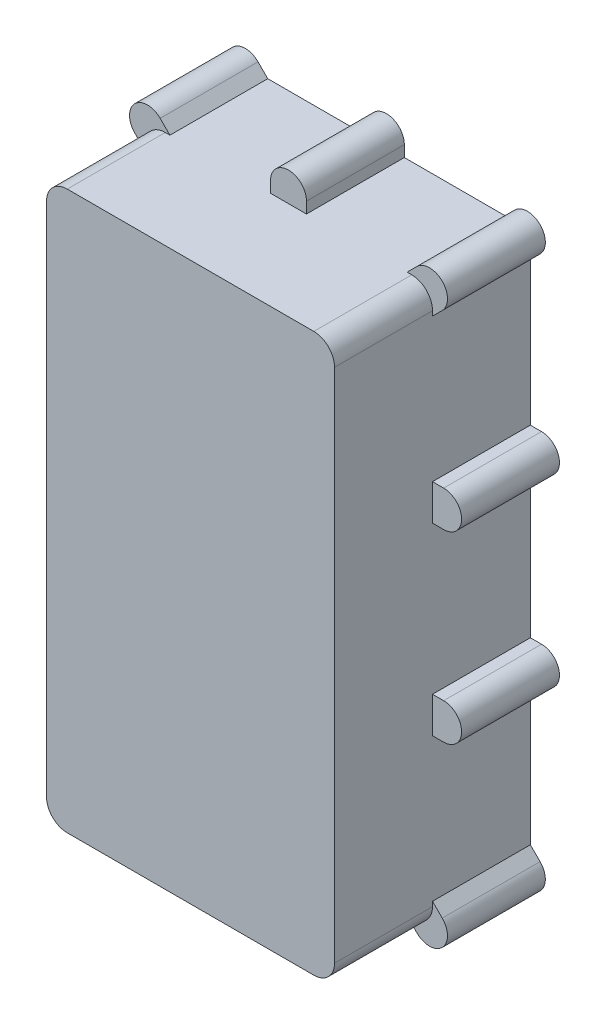
from build123d import *

# Parameters (mm, degrees)
SKETCH3_W               = 76.2
SKETCH3_H               = 158.75
BOSS_EXTRUDE1_DEPTH     = 53.975
SHELL1_T                = 6
FILLET1_R               = 5.334
FILLET2_R               = 6.35
CUT_EXTRUDE1_DEPTH      = 1.2446
FILLET3_R               = 0.254
FILLET4_R               = 0.127
SKETCH7_W               = 76.2
SKETCH7_H               = 2.5
BOSS_EXTRUDE2_DEPTH     = 53.975
BOSS_EXTRUDE3_DEPTH     = 29.972
SKETCH9_R               = 3.025
CUT_EXTRUDE2_DEPTH      = 9
MIRROR2_COPY_1_DEPTH    = 29.972
MIRROR2_COPY_2_SKETCH_R = 3.025
MIRROR2_COPY_2_DEPTH    = 9
BOSS_EXTRUDE4_DEPTH     = 29.972
SKETCH11_R              = 3.025
CUT_EXTRUDE3_DEPTH      = 9
BOSS_EXTRUDE5_DEPTH     = 29.972
SKETCH13_R              = 3.025
CUT_EXTRUDE4_DEPTH      = 9
SKETCH17_R              = 9.525
SKETCH17_R_2            = 6.35
CUT_EXTRUDE6_DEPTH      = 6
SKETCH18_R              = 14.2875
SKETCH18_R_2            = 10.795
CUT_EXTRUDE7_DEPTH      = 3


with BuildPart() as part:
    # Sketch3 → Boss-Extrude1 (new body)
    with BuildSketch(Plane.XY):
        with Locations((38.1, 79.375)):
            Rectangle(SKETCH3_W, SKETCH3_H)
    extrude(amount=BOSS_EXTRUDE1_DEPTH)

    # Shell1
    shell1_openings = [part.faces().sort_by_distance(p)[0] for p in [
        (38.1, 79.375, 0),
    ]]
    offset(amount=SHELL1_T, openings=shell1_openings, kind=Kind.INTERSECTION)

    # Fillet1
    # the kernel refuses this fillet: 5.334 mm, written as the material it adds along each edge
    with BuildSketch(Plane(origin=(0, 158.75, 0), x_dir=(1, 0, 0), z_dir=(0, 0, 1)), Plane(origin=(76.2, 0, 0), x_dir=(-1, 0, 0), z_dir=(0, 0, 1)), Plane(origin=(76.2, 158.75, 0), x_dir=(0, -1, 0), z_dir=(0, 0, 1))) as fillet1_piece_1:
        with BuildLine():
            CenterArc((FILLET1_R, -FILLET1_R), FILLET1_R, 90, 90)
            Line((0, -FILLET1_R), (0, 0))
            Line((0, 0), (FILLET1_R, 0))
        make_face()
    extrude(amount=53.975)
    with BuildSketch(Plane(origin=(0, 0, 0), x_dir=(1, 0, 0), z_dir=(0, 0, 1))) as fillet1_piece_2:
        with BuildLine():
            CenterArc((FILLET1_R, FILLET1_R), FILLET1_R, 180, 90)
            Line((0, FILLET1_R), (0, 0))
            Line((0, 0), (FILLET1_R, 0))
        make_face()
    extrude(amount=53.975)

    # Fillet2
    fillet2_edges = [part.edges().sort_by_distance(p)[0] for p in [
        (-6, 164.75, 29.9875),
        (82.2, 164.75, 29.9875),
        (82.2, -6, 29.9875),
        (-6, -6, 29.9875),
    ]]
    fillet(fillet2_edges, radius=FILLET2_R)

    # Sketch6 → Cut-Extrude1 (cut)
    with BuildSketch(Plane(origin=(0, 0, 0), x_dir=(-1, 0, 0), z_dir=(0, 0, -1))):
        with BuildLine():
            Line((-5.334, 163.0327), (-70.866, 163.0327))
            ThreePointArc((-70.866, 163.0327), (-77.666033783, 160.216033783), (-80.4827, 153.416))
            Line((-80.4827, 153.416), (-80.4827, 5.334))
            ThreePointArc((-80.4827, 5.334), (-77.666033783, -1.466033783), (-70.866, -4.2827))
            Line((-70.866, -4.2827), (-5.334, -4.2827))
            ThreePointArc((-5.334, -4.2827), (1.466033783, -1.466033783), (4.2827, 5.334))
            Line((4.2827, 5.334), (4.2827, 153.416))
            ThreePointArc((4.2827, 153.416), (1.466033783, 160.216033783), (-5.334, 163.0327))
        make_face()
        with BuildLine():
            Line((-77.9173, 153.416), (-77.9173, 5.334))
            ThreePointArc((-77.9173, 5.334), (-75.852022046, 0.347977954), (-70.866, -1.7173))
            Line((-70.866, -1.7173), (-5.334, -1.7173))
            ThreePointArc((-5.334, -1.7173), (-0.347977954, 0.347977954), (1.7173, 5.334))
            Line((1.7173, 5.334), (1.7173, 153.416))
            ThreePointArc((1.7173, 153.416), (-0.347977954, 158.402022046), (-5.334, 160.4673))
            Line((-5.334, 160.4673), (-70.866, 160.4673))
            ThreePointArc((-70.866, 160.4673), (-75.852022046, 158.402022046), (-77.9173, 153.416))
        make_face(mode=Mode.SUBTRACT)
    extrude(amount=-CUT_EXTRUDE1_DEPTH, mode=Mode.SUBTRACT)

    # Fillet3
    fillet3_edges = [part.edges().sort_by_distance(p)[0] for p in [
        (-1.466033783, 160.216033783, 1.2446),
        (-4.2827, 79.375, 1.2446),
        (-1.466033783, -1.466033783, 1.2446),
        (38.1, -4.2827, 1.2446),
        (77.666033783, -1.466033783, 1.2446),
        (80.4827, 79.375, 1.2446),
        (77.666033783, 160.216033783, 1.2446),
        (38.1, 163.0327, 1.2446),
        (38.1, 160.4673, 1.2446),
        (75.852022046, 158.402022046, 1.2446),
        (77.9173, 79.375, 1.2446),
        (75.852022046, 0.347977954, 1.2446),
        (38.1, -1.7173, 1.2446),
        (0.347977954, 0.347977954, 1.2446),
        (-1.7173, 79.375, 1.2446),
        (0.347977954, 158.402022046, 1.2446),
    ]]
    fillet(fillet3_edges, radius=FILLET3_R)

    # Fillet4
    fillet4_edges = [part.edges().sort_by_distance(p)[0] for p in [
        (-1.466033783, 160.216033783, 0),
        (38.1, 163.0327, 0),
        (77.666033783, 160.216033783, 0),
        (80.4827, 79.375, 0),
        (77.666033783, -1.466033783, 0),
        (38.1, -4.2827, 0),
        (-1.466033783, -1.466033783, 0),
        (-4.2827, 79.375, 0),
        (75.852022046, 158.402022046, 0),
        (38.1, 160.4673, 0),
        (0.347977954, 158.402022046, 0),
        (-1.7173, 79.375, 0),
        (0.347977954, 0.347977954, 0),
        (38.1, -1.7173, 0),
        (75.852022046, 0.347977954, 0),
        (77.9173, 79.375, 0),
    ]]
    fillet(fillet4_edges, radius=FILLET4_R)

    # Sketch7 → Boss-Extrude2 (add)
    with BuildSketch(Plane(origin=(0, 0, 53.975), x_dir=(-1, 0, 0), z_dir=(0, 0, -1))):
        with Locations((-38.1, 36.175)):
            Rectangle(SKETCH7_W, SKETCH7_H)
    extrude(amount=BOSS_EXTRUDE2_DEPTH)

    # Sketch8 → Boss-Extrude3 (add)
    with BuildSketch(Plane(origin=(0, 0, 0), x_dir=(-1, 0, 0), z_dir=(0, 0, -1))):
        with BuildLine():
            ThreePointArc((6, 0.35), (5.516635031, -2.080039796), (4.140128061, -4.140128061))
            ThreePointArc((4.140128061, -4.140128061), (2.080039796, -5.516635031), (-0.35, -6))
            Line((-0.35, -6), (-1.778174593, -6))
            Line((-1.778174593, -6), (1.202282953, -8.980457546))
            ThreePointArc((1.202282953, -8.980457546), (8.980457546, -8.980457546), (8.980457546, -1.202282953))
            Line((8.980457546, -1.202282953), (6, 1.778174593))
            Line((6, 1.778174593), (6, 0.35))
        make_face()
    boss_extrude3 = extrude(amount=-BOSS_EXTRUDE3_DEPTH)

    # Sketch9 → Cut-Extrude2 (cut)
    with BuildSketch(Plane(origin=(0, 0, 0), x_dir=(-1, 0, 0), z_dir=(0, 0, -1))):
        with Locations((5.09137025, -5.09137025)):
            Circle(SKETCH9_R)
    cut_extrude2 = extrude(amount=-CUT_EXTRUDE2_DEPTH, mode=Mode.SUBTRACT)

    # Mirror1: Boss-Extrude3, Cut-Extrude2 across plane
    add(boss_extrude3.mirror(Plane.ZY.offset(-38.1)))
    add(cut_extrude2.mirror(Plane.ZY.offset(-38.1)), mode=Mode.SUBTRACT)

    # Mirror2: Boss-Extrude3, Cut-Extrude2 across plane
    add(boss_extrude3.mirror(Plane(origin=(0, 79.375, 0), x_dir=(0, 0, 1), z_dir=(0, -1, 0))))
    add(cut_extrude2.mirror(Plane(origin=(0, 79.375, 0), x_dir=(0, 0, 1), z_dir=(0, -1, 0))), mode=Mode.SUBTRACT)

    # Mirror2 copy 1 sketch → Mirror2 copy 1 (add)
    with BuildSketch(Plane(origin=(76.2, 158.75, 0), x_dir=(1, 0, 0), z_dir=(0, 0, -1))):
        with BuildLine():
            ThreePointArc((6, 0.35), (5.516635031, -2.080039796), (4.140128061, -4.140128061))
            ThreePointArc((4.140128061, -4.140128061), (2.080039796, -5.516635031), (-0.35, -6))
            Line((-0.35, -6), (-1.778174593, -6))
            Line((-1.778174593, -6), (1.202282953, -8.980457546))
            ThreePointArc((1.202282953, -8.980457546), (8.980457546, -8.980457546), (8.980457546, -1.202282953))
            Line((8.980457546, -1.202282953), (6, 1.778174593))
            Line((6, 1.778174593), (6, 0.35))
        make_face()
    extrude(amount=-MIRROR2_COPY_1_DEPTH)

    # Mirror2 copy 2 sketch → Mirror2 copy 2 (cut)
    with BuildSketch(Plane(origin=(76.2, 158.75, 0), x_dir=(1, 0, 0), z_dir=(0, 0, -1))):
        with Locations((5.09137025, -5.09137025)):
            Circle(MIRROR2_COPY_2_SKETCH_R)
    extrude(amount=-MIRROR2_COPY_2_DEPTH, mode=Mode.SUBTRACT)

    # Sketch10 → Boss-Extrude4 (add)
    with BuildSketch(Plane(origin=(0, 0, 0), x_dir=(-1, 0, 0), z_dir=(0, 0, -1))):
        with BuildLine():
            Line((6, 102.069), (9.4097, 102.069))
            ThreePointArc((9.4097, 102.069), (14.9097, 107.569), (9.4097, 113.069))
            Line((9.4097, 113.069), (6, 113.069))
            Line((6, 113.069), (6, 102.069))
        make_face()
        with BuildLine():
            Line((9.4097, 56.681), (6, 56.681))
            Line((6, 56.681), (6, 45.681))
            Line((6, 45.681), (9.4097, 45.681))
            ThreePointArc((9.4097, 45.681), (14.9097, 51.181), (9.4097, 56.681))
        make_face()
    boss_extrude4 = extrude(amount=-BOSS_EXTRUDE4_DEPTH)

    # Sketch11 → Cut-Extrude3 (cut)
    with BuildSketch(Plane(origin=(0, 0, 0), x_dir=(-1, 0, 0), z_dir=(0, 0, -1))):
        with Locations((9.4097, 51.181)):
            Circle(SKETCH11_R)
        with Locations((9.4097, 107.569)):
            Circle(SKETCH11_R)
    cut_extrude3 = extrude(amount=-CUT_EXTRUDE3_DEPTH, mode=Mode.SUBTRACT)

    # Mirror3: Boss-Extrude4, Cut-Extrude3 across plane
    add(boss_extrude4.mirror(Plane.ZY.offset(-38.1)))
    add(cut_extrude3.mirror(Plane.ZY.offset(-38.1)), mode=Mode.SUBTRACT)

    # Sketch12 → Boss-Extrude5 (add)
    with BuildSketch(Plane(origin=(0, 0, 0), x_dir=(-1, 0, 0), z_dir=(0, 0, -1))):
        with BuildLine():
            Line((-43.6, -6), (-43.6, -9.4097))
            ThreePointArc((-43.6, -9.4097), (-38.1, -14.9097), (-32.6, -9.4097))
            Line((-32.6, -9.4097), (-32.6, -6))
            Line((-32.6, -6), (-43.6, -6))
        make_face()
    boss_extrude5 = extrude(amount=-BOSS_EXTRUDE5_DEPTH)

    # Sketch13 → Cut-Extrude4 (cut)
    with BuildSketch(Plane(origin=(0, 0, 0), x_dir=(-1, 0, 0), z_dir=(0, 0, -1))):
        with Locations((-38.1, -9.4097)):
            Circle(SKETCH13_R)
    cut_extrude4 = extrude(amount=-CUT_EXTRUDE4_DEPTH, mode=Mode.SUBTRACT)

    # Mirror4: Boss-Extrude5, Cut-Extrude4 across plane
    add(boss_extrude5.mirror(Plane(origin=(0, 79.375, 0), x_dir=(0, 0, 1), z_dir=(0, -1, 0))))
    add(cut_extrude4.mirror(Plane(origin=(0, 79.375, 0), x_dir=(0, 0, 1), z_dir=(0, -1, 0))), mode=Mode.SUBTRACT)

    # Sketch17 → Cut-Extrude6 (cut)
    with BuildSketch(Plane.ZY.offset(6)):
        with Locations(Location((38.385, 119.975, 0), (0, 0, 270))):
            Circle(SKETCH17_R)
        with Locations(Location((38.385, 20.1295, 0), (0, 0, 270))):
            Circle(SKETCH17_R_2)
    extrude(amount=-CUT_EXTRUDE6_DEPTH, mode=Mode.SUBTRACT)

    # Sketch18 → Cut-Extrude7 (cut)
    with BuildSketch(Plane(origin=(0, 0, 0), x_dir=(0, 0, -1), z_dir=(1, 0, 0))):
        with Locations(Location((-38.385, 119.975, 0), (0, 0, 90))):
            Circle(SKETCH18_R)
        with Locations(Location((-38.385, 20.1295, 0), (0, 0, 90))):
            Circle(SKETCH18_R_2)
    extrude(amount=-CUT_EXTRUDE7_DEPTH, mode=Mode.SUBTRACT)


solid = part.part
